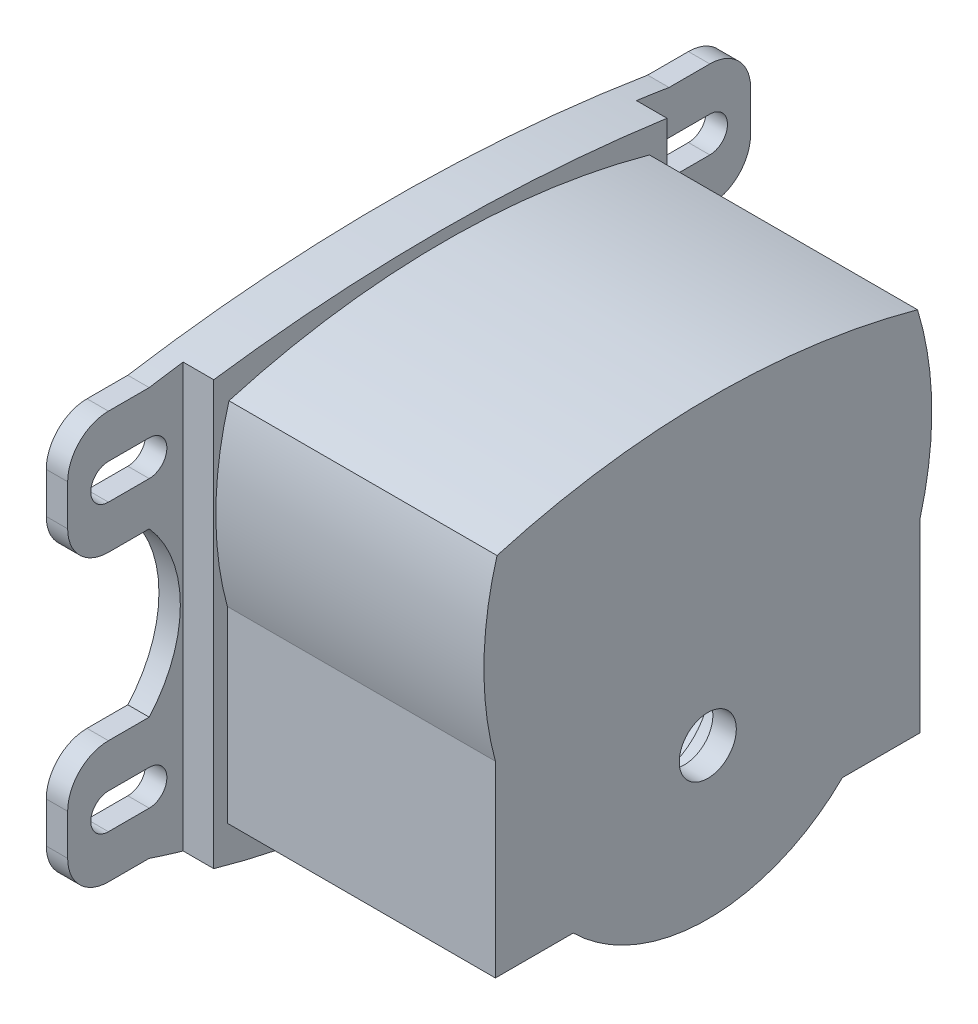
from build123d import *

# Parameters (mm, degrees)
BOSS_EXTRUDE2_DEPTH       = 16.1925
BOSS_EXTRUDE3_DEPTH       = 16.1925
CUT_EXTRUDE1_DEPTH        = 133.157398694
M10_CLEARANCE_SLOT1_DEPTH = 16.1925
CUT_EXTRUDE2_DEPTH        = 9.525
BOSS_EXTRUDE13_DEPTH      = 83.5025
CUT_EXTRUDE6_DEPTH        = 66.548
CUT_EXTRUDE7_DEPTH        = 76.2
CUT_EXTRUDE7_DEPTH_BACK   = 10.16
SKETCH39_R                = 17.78
SKETCH39_R_2              = 19.05
SKETCH40_R                = 7.9375
SKETCH40_R_2              = 9.61898
CUT_EXTRUDE8_DEPTH        = 156.486489701
SKETCH41_R                = 8.89
CUT_EXTRUDE9_DEPTH        = 24.892
SKETCH42_R                = 2.54
SKETCH42_R_2              = 3.81
CUT_EXTRUDE10_DEPTH       = 12.7


# Read off the part's stored shape, not the designer's step: M10 Clearance Slot1
with BuildPart() as part:
    # Sketch2 → Boss-Extrude2 (new body)
    with BuildSketch(Plane.YZ):
        with BuildLine():
            Line((-50.8, -106.3625), (50.8, -106.3625))
            ThreePointArc((50.8, -106.3625), (59.780256121, -102.642756121), (63.5, -93.6625))
            Line((63.5, -93.6625), (63.5, 93.6625))
            ThreePointArc((63.5, 93.6625), (59.780256121, 102.642756121), (50.8, 106.3625))
            Line((50.8, 106.3625), (-50.8, 106.3625))
            ThreePointArc((-50.8, 106.3625), (-59.780256121, 102.642756121), (-63.5, 93.6625))
            Line((-63.5, 93.6625), (-63.5, -93.6625))
            ThreePointArc((-63.5, -93.6625), (-59.780256121, -102.642756121), (-50.8, -106.3625))
        make_face()
    extrude(amount=BOSS_EXTRUDE2_DEPTH)

    # Sketch14 → Boss-Extrude3 (add)
    with BuildSketch(Plane.YZ):
        with BuildLine():
            Line((-63.5, -80.9625), (63.5, -80.9625))
            ThreePointArc((63.5, -80.9625), (69.993196862, 0), (63.5, 80.9625))
            Line((63.5, 80.9625), (-63.5, 80.9625))
            ThreePointArc((-63.5, 80.9625), (-76.748938541, 0), (-63.5, -80.9625))
        make_face()
    extrude(amount=BOSS_EXTRUDE3_DEPTH)

    # Sketch15 → Cut-Extrude1 (cut, through all)
    with BuildSketch(Plane.YZ.offset(16.1925)):
        with BuildLine():
            Line((-38.1, -106.3625), (38.1, -106.3625))
            ThreePointArc((38.1, -106.3625), (29.119743879, -102.642756121), (25.4, -93.6625))
            Line((25.4, -93.6625), (25.4, -80.9625))
            ThreePointArc((25.4, -80.9625), (0, -71.260563314), (-25.4, -80.9625))
            Line((-25.4, -80.9625), (-25.4, -93.6625))
            ThreePointArc((-25.4, -93.6625), (-29.119743879, -102.642756121), (-38.1, -106.3625))
        make_face()
        with BuildLine():
            Line((-38.1, 106.3625), (38.1, 106.3625))
            ThreePointArc((38.1, 106.3625), (29.119743879, 102.642756121), (25.4, 93.6625))
            Line((25.4, 93.6625), (25.4, 80.9625))
            ThreePointArc((25.4, 80.9625), (0, 71.260563314), (-25.4, 80.9625))
            Line((-25.4, 80.9625), (-25.4, 93.6625))
            ThreePointArc((-25.4, 93.6625), (-29.119743879, 102.642756121), (-38.1, 106.3625))
        make_face()
    extrude(amount=-CUT_EXTRUDE1_DEPTH, mode=Mode.SUBTRACT)

    # M10 Clearance Slot1 outline → M10 Clearance Slot1 (cut)
    with BuildSketch(Plane.YZ):
        with BuildLine():
            Line((-38.95, -93.6625), (-38.95, -80.9625))
            ThreePointArc((-38.95, -80.9625), (-44.45, -75.4625), (-49.95, -80.9625))
            Line((-49.95, -80.9625), (-49.95, -93.6625))
            ThreePointArc((-49.95, -93.6625), (-44.45, -99.1625), (-38.95, -93.6625))
        make_face()
        with BuildLine():
            ThreePointArc((-38.95, 93.6625), (-44.45, 99.1625), (-49.95, 93.6625))
            Line((-49.95, 93.6625), (-49.95, 80.9625))
            ThreePointArc((-49.95, 80.9625), (-44.45, 75.4625), (-38.95, 80.9625))
            Line((-38.95, 80.9625), (-38.95, 93.6625))
        make_face()
        with BuildLine():
            Line((49.95, -93.6625), (49.95, -80.9625))
            ThreePointArc((49.95, -80.9625), (44.45, -75.4625), (38.95, -80.9625))
            Line((38.95, -80.9625), (38.95, -93.6625))
            ThreePointArc((38.95, -93.6625), (44.45, -99.1625), (49.95, -93.6625))
        make_face()
        with BuildLine():
            ThreePointArc((49.95, 93.6625), (44.45, 99.1625), (38.95, 93.6625))
            Line((38.95, 93.6625), (38.95, 80.9625))
            ThreePointArc((38.95, 80.9625), (44.45, 75.4625), (49.95, 80.9625))
            Line((49.95, 80.9625), (49.95, 93.6625))
        make_face()
    extrude(amount=M10_CLEARANCE_SLOT1_DEPTH, mode=Mode.SUBTRACT)

    # Sketch31 → Cut-Extrude2 (cut)
    with BuildSketch(Plane.YZ.offset(16.1925)):
        Polygon((-63.5, 106.3625), (63.5, 106.3625), (65.093481902, 106.3625), (65.093481902, 70.385390475), (63.5, 70.385390475), (-63.5, 70.385390475), (-66.802, 70.385390475), (-66.802, 106.3625), align=None)
        Polygon((-63.5, -106.3625), (63.5, -106.3625), (65.03495059, -106.3625), (65.03495059, -70.8025), (63.5, -70.8025), (-63.5, -70.8025), (-66.681318502, -70.8025), (-66.681318502, -106.3625), align=None)
    extrude(amount=-CUT_EXTRUDE2_DEPTH, mode=Mode.SUBTRACT)

    # Sketch35 → Boss-Extrude13 (add)
    with BuildSketch(Plane.YZ.offset(16.1925)):
        with BuildLine():
            Line((-56.656792843, -66.178226808), (1.373429882, -66.178226808))
            ThreePointArc((1.373429882, -66.178226808), (29.681734779, -69.76216524), (57.870185881, -65.333173792))
            ThreePointArc((57.870185881, -65.333173792), (66.517752315, 0.213764908), (57.050540491, 65.647345572))
            ThreePointArc((57.050540491, 65.647345572), (29.463073407, 69.728791712), (1.805161675, 66.155773192))
            Line((1.805161675, 66.155773192), (-56.656792843, 66.155773192))
            Line((-56.656792843, 66.155773192), (-56.656792843, 41.91021734))
            ThreePointArc((-56.656792843, 41.91021734), (-73.855751192, -0.011226808), (-56.656792843, -41.932670956))
            Line((-56.656792843, -41.932670956), (-56.656792843, -66.178226808))
        make_face()
    extrude(amount=BOSS_EXTRUDE13_DEPTH)

    # Sketch38 → Cut-Extrude6 (cut)
    with BuildSketch(Plane.YZ.offset(16.1925)):
        with BuildLine():
            Line((54.087207157, 57.265773192), (54.087207157, -1.408226808))
            ThreePointArc((54.087207157, -1.408226808), (62.460842713, -29.348226808), (54.087207157, -57.288226808))
            ThreePointArc((54.087207157, -57.288226808), (28.687207157, -62.9621542), (3.287207157, -57.288226808))
            Line((3.287207157, -57.288226808), (-47.766792843, -57.288226808))
            Line((-47.766792843, -57.288226808), (-47.766792843, -38.111226808))
            ThreePointArc((-47.766792843, -38.111226808), (-64.965751192, -0.011226808), (-47.766792843, 38.088773192))
            Line((-47.766792843, 38.088773192), (-47.766792843, 57.265773192))
            Line((-47.766792843, 57.265773192), (3.287207157, 57.265773192))
            ThreePointArc((3.287207157, 57.265773192), (28.687207157, 61.623724224), (54.087207157, 57.265773192))
        make_face()
    extrude(amount=CUT_EXTRUDE6_DEPTH, mode=Mode.SUBTRACT)

    # Sketch39 → Cut-Extrude7 (cut, two sides: drawn at the far end of the back side and taken through both)
    with BuildSketch(Plane.YZ.offset(16.1925).offset(-CUT_EXTRUDE7_DEPTH_BACK)):
        with Locations(Location((17.365170467, 39.602870467, 0), (0, 0, 90))):
            Circle(SKETCH39_R)
        with Locations(Location((26.26578479, -28.0035, 0), (0, 0, 90))):
            Circle(SKETCH39_R_2)
        with Locations(Location((-27.0002, 0, 0), (0, 0, 90))):
            Circle(SKETCH39_R)
    extrude(amount=CUT_EXTRUDE7_DEPTH + CUT_EXTRUDE7_DEPTH_BACK, mode=Mode.SUBTRACT)

    # Sketch40 → Cut-Extrude8 (cut, through all)
    with BuildSketch(Plane.YZ.offset(16.1925)):
        with Locations(Location((17.365170467, 39.602870467, 0), (0, 0, 270))):
            Circle(SKETCH40_R)
        with Locations(Location((26.26578479, -28.0035, 0), (0, 0, 270))):
            Circle(SKETCH40_R_2)
    extrude(amount=-CUT_EXTRUDE8_DEPTH, mode=Mode.SUBTRACT)

    # Sketch41 → Cut-Extrude9 (cut)
    with BuildSketch(Plane.YZ.offset(99.695)):
        with Locations(Location((-27.0002, 0, 0), (0, 0, 270))):
            Circle(SKETCH41_R)
    extrude(amount=-CUT_EXTRUDE9_DEPTH, mode=Mode.SUBTRACT)

    # Sketch42 → Cut-Extrude10 (cut, symmetric)
    with BuildSketch(Plane.YZ.offset(16.1925)):
        with Locations(Location((29.681734779, -66.35801684, 0), (0, 0, 270))):
            Circle(SKETCH42_R)
        with Locations(Location((59.416679264, 27.928773192, 0), (0, 0, 270))):
            Circle(SKETCH42_R_2)
        with Locations(Location((29.463073407, 65.674282954, 0), (0, 0, 270))):
            Circle(SKETCH42_R)
        with Locations(Location((-52.211792843, 61.710773192, 0), (0, 0, 270))):
            Circle(SKETCH42_R_2)
        with Locations(Location((-52.211792843, -61.733226808, 0), (0, 0, 270))):
            Circle(SKETCH42_R_2)
    extrude(amount=CUT_EXTRUDE10_DEPTH, both=True, mode=Mode.SUBTRACT)


solid = part.part
